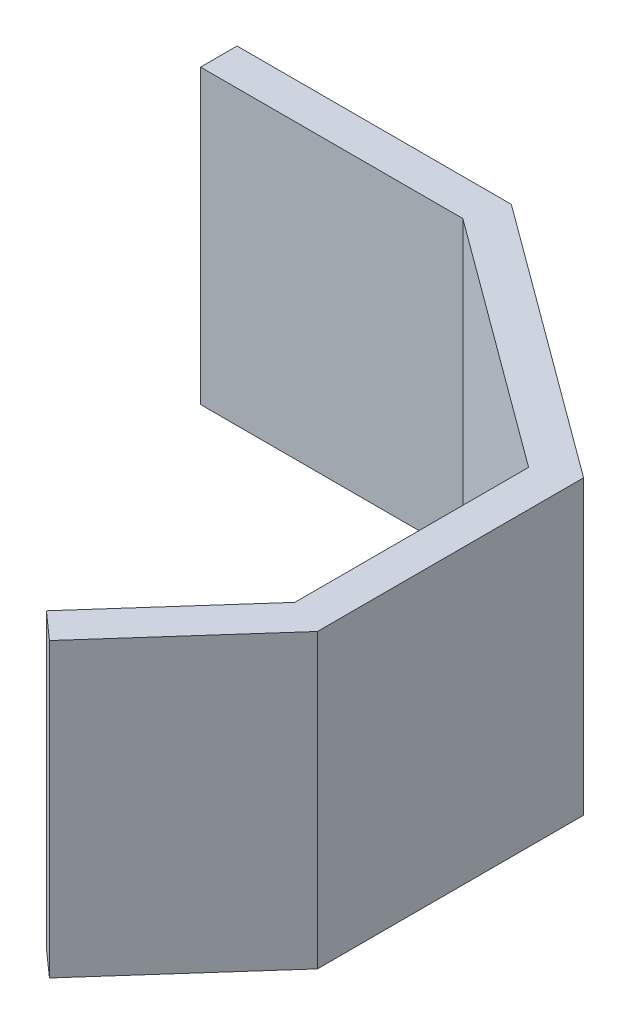
from build123d import *

# Parameters (mm, degrees)
EXTRUDE_1_DEPTH      = 10
EXTRUDE_1_DEPTH_BACK = 10


with BuildPart() as part:
    # 草图1 → 凸台-拉伸1 (new, two sides: drawn at the far end of the back side and taken through both)
    with BuildSketch(Plane(origin=(0, 0, 0), x_dir=(1, 0, 0), z_dir=(0, 1, 0)).offset(-EXTRUDE_1_DEPTH_BACK)):
        Polygon((0, -8), (0, 8), (-17, 20.5), (-34.950940927, 20.5), (-34.950940927, 23), (-16.179810431, 23), (2.5, 9.264845271), (2.5, -8.950498306), (-6.131476703, -18.660909597), (-8, -17), align=None)
    extrude(amount=EXTRUDE_1_DEPTH + EXTRUDE_1_DEPTH_BACK)


solid = part.part
